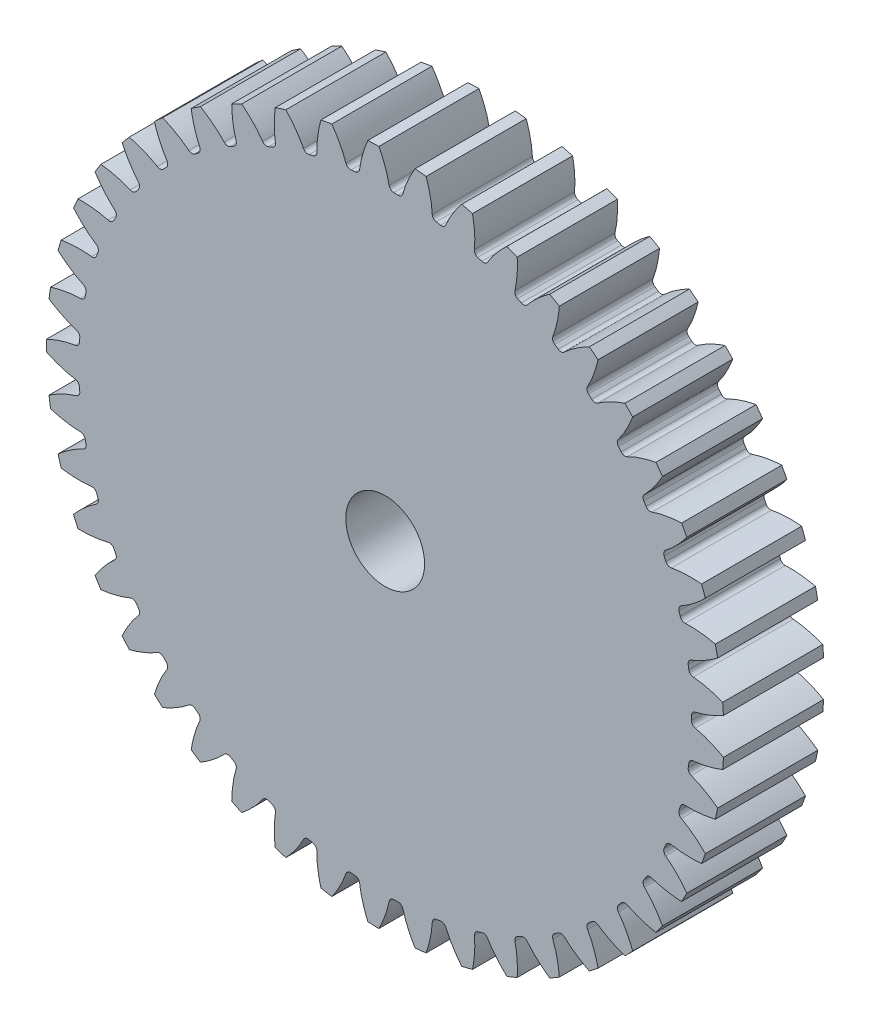
from build123d import *

# Parameters (mm, degrees)
SKETCH1_R                = 21.48605
BOSS_EXTRUDE1_DEPTH      = 6.35
CUT_EXTRUDE1_REACH       = 33.042
FILLET1_R                = 0.306752254
CIRPATTERN1_COUNT        = 45
FILLET1_OF_CIRPATTERN1_R = 0.306752254
CUT_EXTRUDE2_REACH       = 33.04
SKETCH4_R                = 2.5


with BuildPart() as part:
    # Sketch1 → Boss-Extrude1 (new body)
    with BuildSketch(Plane.XY):
        Circle(SKETCH1_R)
    extrude(amount=-BOSS_EXTRUDE1_DEPTH)

    # Sketch2 → Cut-Extrude1 (cut, up to next)
    with BuildSketch(Plane.XY, mode=Mode.PRIVATE) as cut_extrude1_sk1:
        with BuildLine():
            ThreePointArc((19.424855763, 0.39517383), (19.428875, 0), (19.424855763, -0.39517383))
            add(Edge.make_bspline(
                [(19.424855763, -0.39517383), (19.42600666, -0.395313608), (19.449865786, -0.398229576), (19.504143939, -0.405716832), (19.588796681, -0.420035562), (19.717178174, -0.446347184), (19.867508431, -0.48309865), (20.031608397, -0.52948639), (20.20878178, -0.586386823), (20.384209147, -0.64880926), (20.557852422, -0.716305677), (20.729531451, -0.788235355), (20.935833072, -0.880863136), (21.138867571, -0.979224777), (21.298139367, -1.062091335), (21.414728382, -1.125570839), (21.455357381, -1.148034959)],
                knots=[0.014402179, 0.014402179, 0.014402179, 0.014402179, 0.014402179, 0.015083688, 0.02853182, 0.046610139, 0.064854849, 0.092110525, 0.119476176, 0.146842496, 0.174208854, 0.201574956, 0.228941013, 0.256307345, 0.307035032, 0.334332623, 0.334332623, 0.334332623, 0.334332623, 0.334332623], degree=4))
            ThreePointArc((21.455357381, -1.148034959), (21.48605, 0), (21.455357381, 1.148034959))
            add(Edge.make_bspline(
                [(21.455357381, 1.148034959), (21.414728382, 1.125570839), (21.298139367, 1.062091335), (21.138867571, 0.979224777), (20.935833072, 0.880863136), (20.729531451, 0.788235355), (20.557852422, 0.716305677), (20.384209147, 0.64880926), (20.20878178, 0.586386823), (20.031608397, 0.52948639), (19.867508431, 0.48309865), (19.717178174, 0.446347184), (19.588796681, 0.420035562), (19.504143939, 0.405716832), (19.449865786, 0.398229576), (19.42600666, 0.395313608), (19.424855763, 0.39517383)],
                knots=[0.188172962, 0.188172962, 0.188172962, 0.188172962, 0.188172962, 0.215470553, 0.26619824, 0.293564572, 0.32093063, 0.348296731, 0.37566309, 0.40302941, 0.43039506, 0.457650736, 0.475895446, 0.493973765, 0.507421897, 0.508103406, 0.508103406, 0.508103406, 0.508103406, 0.508103406], degree=4))
        make_face()
    cut_extrude1_tool1 = extrude(cut_extrude1_sk1.sketch, amount=-CUT_EXTRUDE1_REACH, mode=Mode.PRIVATE) & part.part
    cut_extrude1 = cut_extrude1_tool1.solids().sort_by_distance((20.638267, 0, 0))[0]
    add(cut_extrude1, mode=Mode.SUBTRACT)

    # Fillet1
    fillet1_edges = [part.edges().sort_by_distance(p)[0] for p in [
        (19.424855763, -0.39517383, -3.175),
        (19.424855763, 0.39517383, -3.175),
    ]]
    fillet(fillet1_edges, radius=FILLET1_R)

    # CirPattern1: Cut-Extrude1 ×45 about axis
    cirpattern1_axis = Axis((0, 0, 0), (0, 0, 1))
    for i in range(1, CIRPATTERN1_COUNT):
        add(cut_extrude1.rotate(cirpattern1_axis, i * 360 / CIRPATTERN1_COUNT), mode=Mode.SUBTRACT)

    # Fillet1 of CirPattern1
    fillet1_of_cirpattern1_edges = [part.edges().sort_by_distance(p)[0] for p in [
        (19.290811969, 2.312089386, -3.175),
        (19.180816835, 3.094745438, -3.175),
        (18.781294464, 4.974350413, -3.175),
        (18.563445124, 5.734081346, -3.175),
        (17.906220425, 7.539791368, -3.175),
        (17.58475707, 8.261809883, -3.175),
        (16.682622173, 9.958478859, -3.175),
        (16.263801722, 10.628731688, -3.175),
        (15.134315657, 12.183335888, -3.175),
        (14.626289974, 12.788777321, -3.175),
        (13.291436902, 14.171058141, -3.175),
        (12.704094128, 14.699903951, -3.175),
        (11.189855447, 15.882956867, -3.175),
        (10.534627541, 16.32491367, -3.175),
        (8.870476183, 17.285711905, -3.175),
        (8.160116411, 17.632177515, -3.175),
        (6.37844319, 18.352020222, -3.175),
        (5.626777898, 18.596251081, -3.175),
        (3.762261057, 19.061127341, -3.175),
        (2.983920553, 19.198369772, -3.175),
        (1.072850791, 19.399231298, -3.175),
        (0.282984589, 19.426814033, -3.175),
        (-1.637441295, 19.359751284, -3.175),
        (-2.423459349, 19.277137457, -3.175),
        (-4.315862449, 18.943455732, -3.175),
        (-5.082733407, 18.752253328, -3.175),
        (-6.91028025, 18.158447363, -3.175),
        (-7.64307784, 17.862377918, -3.175),
        (-9.370197305, 17.020005471, -3.175),
        (-10.054658457, 16.62483164, -3.175),
        (-11.647734129, 15.550288532, -3.175),
        (-12.270536585, 15.063701925, -3.175),
        (-13.698561057, 13.777902915, -3.175),
        (-14.247582675, 13.209374386, -3.175),
        (-15.482761076, 11.73734609, -3.175),
        (-15.947315775, 11.097941401, -3.175),
        (-16.965606762, 9.468335174, -3.175),
        (-17.336652513, 8.77049961, -3.175),
        (-18.11823621, 7.015033884, -3.175),
        (-18.38855103, 6.27235002, -3.175),
        (-18.9182148, 4.42519294, -3.175),
        (-19.082537318, 3.652116272, -3.175),
        (-19.349971858, 1.749220648, -3.175),
        (-19.405103723, 0.960798234, -3.175),
        (-19.405103723, -0.960798234, -3.175),
        (-19.349971858, -1.749220648, -3.175),
        (-19.082537318, -3.652116272, -3.175),
        (-18.9182148, -4.42519294, -3.175),
        (-18.38855103, -6.27235002, -3.175),
        (-18.11823621, -7.015033884, -3.175),
        (-17.336652513, -8.77049961, -3.175),
        (-16.965606762, -9.468335174, -3.175),
        (-15.947315775, -11.097941401, -3.175),
        (-15.482761076, -11.73734609, -3.175),
        (-14.247582675, -13.209374386, -3.175),
        (-13.698561057, -13.777902915, -3.175),
        (-12.270536585, -15.063701925, -3.175),
        (-11.647734129, -15.550288532, -3.175),
        (-10.054658457, -16.62483164, -3.175),
        (-9.370197305, -17.020005471, -3.175),
        (-7.64307784, -17.862377918, -3.175),
        (-6.91028025, -18.158447363, -3.175),
        (-5.082733407, -18.752253328, -3.175),
        (-4.315862449, -18.943455732, -3.175),
        (-2.423459349, -19.277137457, -3.175),
        (-1.637441295, -19.359751284, -3.175),
        (0.282984589, -19.426814033, -3.175),
        (1.072850791, -19.399231298, -3.175),
        (2.983920553, -19.198369772, -3.175),
        (3.762261057, -19.061127341, -3.175),
        (5.626777898, -18.596251081, -3.175),
        (6.37844319, -18.352020222, -3.175),
        (8.160116411, -17.632177515, -3.175),
        (8.870476183, -17.285711905, -3.175),
        (10.534627541, -16.32491367, -3.175),
        (11.189855447, -15.882956867, -3.175),
        (12.704094128, -14.699903951, -3.175),
        (13.291436902, -14.171058141, -3.175),
        (14.626289974, -12.788777321, -3.175),
        (15.134315657, -12.183335888, -3.175),
        (16.263801722, -10.628731688, -3.175),
        (16.682622173, -9.958478859, -3.175),
        (17.58475707, -8.261809883, -3.175),
        (17.906220425, -7.539791368, -3.175),
        (18.563445124, -5.734081346, -3.175),
        (18.781294464, -4.974350413, -3.175),
        (19.180816835, -3.094745438, -3.175),
        (19.290811969, -2.312089386, -3.175),
    ]]
    fillet(fillet1_of_cirpattern1_edges, radius=FILLET1_OF_CIRPATTERN1_R)

    # Sketch4 → Cut-Extrude2 (cut, up to next)
    with BuildSketch(Plane.XY, mode=Mode.PRIVATE) as cut_extrude2_sk1:
        Circle(SKETCH4_R)
    cut_extrude2_tool1 = extrude(cut_extrude2_sk1.sketch, amount=-CUT_EXTRUDE2_REACH, mode=Mode.PRIVATE) & part.part
    add(cut_extrude2_tool1.solids().sort_by_distance((0, 0, 0))[0], mode=Mode.SUBTRACT)


solid = part.part
